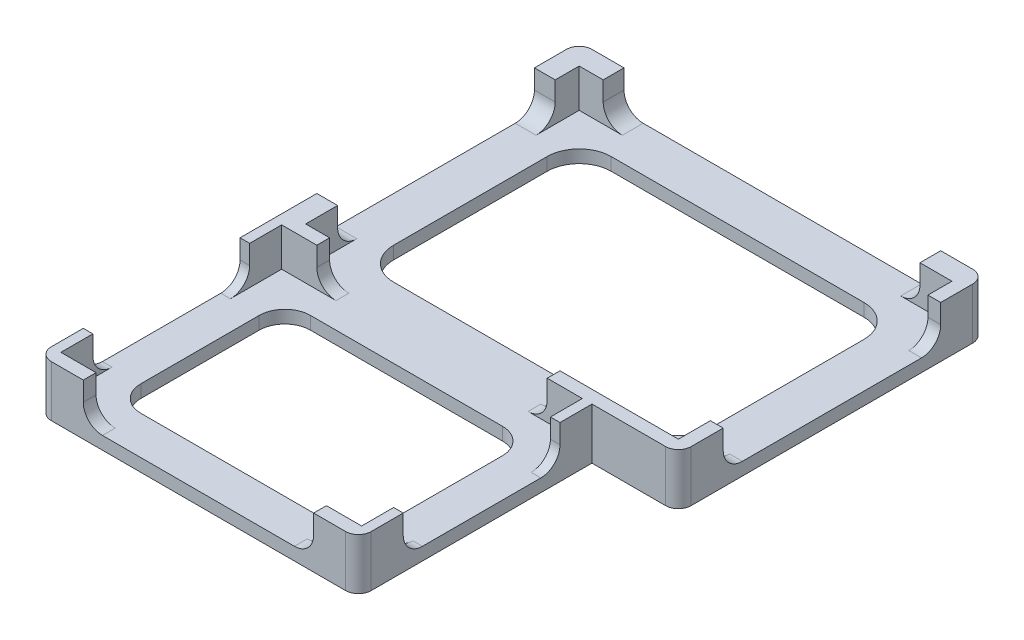
from build123d import *

# Parameters (mm, degrees)
SKETCH1_W            = 63.5
SKETCH1_H            = 48
BOSS_EXTRUDE6_DEPTH  = 21
SKETCH5_W            = 50
SKETCH5_H            = 38.5
BOSS_EXTRUDE7_DEPTH  = 11.5
SKETCH6_W            = 59.5
SKETCH6_H            = 44
CUT_EXTRUDE1_DEPTH   = 19
SKETCH7_W            = 46
SKETCH7_H            = 34.5
CUT_EXTRUDE2_DEPTH   = 9.5
SKETCH8_W            = 50
SKETCH8_H            = 11.5
CUT_EXTRUDE4_DEPTH   = 2
CUT_EXTRUDE6_DEPTH   = 2
CUT_EXTRUDE7_DEPTH   = 2
CUT_EXTRUDE10_DEPTH  = 72
CUT_EXTRUDE11_DEPTH  = 38
SKETCH16_W           = 67
SKETCH16_H           = 6.5
CUT_EXTRUDE13_DEPTH  = 79
CUT_EXTRUDE14_DEPTH  = 79
CUT_EXTRUDE15_DEPTH  = 79
FILLET1_R            = 2
FILLET2_R            = 2
FILLET3_R            = 2
FILLET4_R            = 2
FILLET5_R            = 2
SKETCH19_W           = 36.5
SKETCH19_H           = 2
CUT_EXTRUDE17_DEPTH  = 79
FILLET6_R            = 5
FILLET7_R            = 5
SKETCH20_W           = 4
SKETCH20_H           = 2
BOSS_EXTRUDE16_DEPTH = 18
SKETCH30_W           = 4
SKETCH30_H           = 1
BOSS_EXTRUDE17_DEPTH = 2
SKETCH33_W           = 4
SKETCH33_H           = 1.5
BOSS_EXTRUDE18_DEPTH = 4
SKETCH34_W           = 4
SKETCH34_H           = 1
BOSS_EXTRUDE19_DEPTH = 2
SKETCH36_W           = 4
SKETCH36_H           = 1
CUT_EXTRUDE21_DEPTH  = 2
CUT_EXTRUDE22_DEPTH  = 7
CUT_EXTRUDE25_DEPTH  = 7
SKETCH39_W           = 9.212342007
SKETCH39_H           = 18
CUT_EXTRUDE26_DEPTH  = 10
SKETCH40_W           = 63.5
SKETCH40_H           = 6.5
CUT_EXTRUDE27_DEPTH  = 117
SKETCH44_W           = 34.5
SKETCH44_H           = 6
CUT_EXTRUDE30_DEPTH  = 0.5
SKETCH45_W           = 34.5
SKETCH45_H           = 6
CUT_EXTRUDE31_DEPTH  = 0.5
SKETCH46_W           = 44
SKETCH46_H           = 6
BOSS_EXTRUDE20_DEPTH = 1.25
SKETCH47_W           = 58.25
SKETCH47_H           = 6
BOSS_EXTRUDE21_DEPTH = 1.25
CUT_EXTRUDE32_START  = -1.25
CUT_EXTRUDE32_DEPTH  = 1.25
CUT_EXTRUDE33_DEPTH  = 1.25


with BuildPart() as part:
    # Sketch1 → Boss-Extrude6 (new body)
    with BuildSketch(Plane(origin=(0, 0, 0), x_dir=(1, 0, 0), z_dir=(0, 1, 0))):
        with Locations((31.75, 24)):
            Rectangle(SKETCH1_W, SKETCH1_H)
    extrude(amount=BOSS_EXTRUDE6_DEPTH)

    # Sketch5 → Boss-Extrude7 (add)
    with BuildSketch(Plane(origin=(0, 0, 0), x_dir=(-1, 0, 0), z_dir=(0, -1, 0))):
        with Locations((-25, -19.25)):
            Rectangle(SKETCH5_W, SKETCH5_H)
    extrude(amount=-BOSS_EXTRUDE7_DEPTH)

    # Sketch6 → Cut-Extrude1 (cut)
    with BuildSketch(Plane(origin=(0, 21, 0), x_dir=(1, 0, 0), z_dir=(0, 1, 0))):
        with Locations((31.75, 24)):
            Rectangle(SKETCH6_W, SKETCH6_H)
    extrude(amount=-CUT_EXTRUDE1_DEPTH, mode=Mode.SUBTRACT)

    # Sketch7 → Cut-Extrude2 (cut)
    with BuildSketch(Plane(origin=(0, 11.5, 0), x_dir=(1, 0, 0), z_dir=(0, 1, 0))):
        with Locations((25, -17.25)):
            Rectangle(SKETCH7_W, SKETCH7_H)
    extrude(amount=-CUT_EXTRUDE2_DEPTH, mode=Mode.SUBTRACT)

    # Sketch8 → Cut-Extrude4 (cut)
    with BuildSketch(Plane.XY.offset(38.5)):
        with Locations((25, 5.75)):
            Rectangle(SKETCH8_W, SKETCH8_H)
    extrude(amount=-CUT_EXTRUDE4_DEPTH, mode=Mode.SUBTRACT)

    # Sketch10 → Cut-Extrude6 (cut)
    with BuildSketch(Plane(origin=(0, 2, 0), x_dir=(1, 0, 0), z_dir=(0, 1, 0))):
        with BuildLine():
            Line((12, 7), (51.5, 7))
            ThreePointArc((51.5, 7), (55.035533906, 8.464466094), (56.5, 12))
            Line((56.5, 12), (56.5, 36))
            ThreePointArc((56.5, 36), (55.035533906, 39.535533906), (51.5, 41))
            Line((51.5, 41), (12, 41))
            ThreePointArc((12, 41), (8.464466094, 39.535533906), (7, 36))
            Line((7, 36), (7, 12))
            ThreePointArc((7, 12), (8.464466094, 8.464466094), (12, 7))
        make_face()
    extrude(amount=-CUT_EXTRUDE6_DEPTH, mode=Mode.SUBTRACT)

    # Sketch11 → Cut-Extrude7 (cut)
    with BuildSketch(Plane(origin=(0, 2, 0), x_dir=(1, 0, 0), z_dir=(0, 1, 0))):
        with BuildLine():
            Line((10, -30.5), (40, -30.5))
            ThreePointArc((40, -30.5), (42.828427125, -29.328427125), (44, -26.5))
            Line((44, -26.5), (44, -8))
            ThreePointArc((44, -8), (42.828427125, -5.171572875), (40, -4))
            Line((40, -4), (10, -4))
            ThreePointArc((10, -4), (7.171572875, -5.171572875), (6, -8))
            Line((6, -8), (6, -26.5))
            ThreePointArc((6, -26.5), (7.171572875, -29.328427125), (10, -30.5))
        make_face()
    extrude(amount=-CUT_EXTRUDE7_DEPTH, mode=Mode.SUBTRACT)

    # Sketch13 → Cut-Extrude10 (cut)
    with BuildSketch(Plane(origin=(63.5, 0, 0), x_dir=(0, 0, -1), z_dir=(1, 0, 0))):
        with BuildLine():
            Line((7, 21), (41, 21))
            Line((41, 21), (41, 5))
            ThreePointArc((41, 5), (40.121320344, 2.878679656), (38, 2))
            Line((38, 2), (10, 2))
            ThreePointArc((10, 2), (7.878679656, 2.878679656), (7, 5))
            Line((7, 5), (7, 21))
        make_face()
    extrude(amount=-CUT_EXTRUDE10_DEPTH, mode=Mode.SUBTRACT)

    # Sketch14 → Cut-Extrude11 (cut)
    with BuildSketch(Plane(origin=(0, 0, -48), x_dir=(-1, 0, 0), z_dir=(0, 0, -1))):
        with BuildLine():
            Line((-56.5, 21), (-7, 21))
            Line((-7, 21), (-7, 5))
            ThreePointArc((-7, 5), (-7.878679656, 2.878679656), (-10, 2))
            Line((-10, 2), (-53.5, 2))
            ThreePointArc((-53.5, 2), (-55.621320344, 2.878679656), (-56.5, 5))
            Line((-56.5, 5), (-56.5, 21))
        make_face()
    extrude(amount=-CUT_EXTRUDE11_DEPTH, mode=Mode.SUBTRACT)

    # Sketch16 → Cut-Extrude13 (cut)
    with BuildSketch(Plane(origin=(63.5, 0, 0), x_dir=(0, 0, -1), z_dir=(1, 0, 0))):
        with Locations((14.5, 17.75)):
            Rectangle(SKETCH16_W, SKETCH16_H)
    extrude(amount=-CUT_EXTRUDE13_DEPTH, mode=Mode.SUBTRACT)

    # Sketch17 → Cut-Extrude14 (cut)
    with BuildSketch(Plane(origin=(0, 0, -2), x_dir=(-1, 0, 0), z_dir=(0, 0, -1))):
        with BuildLine():
            Line((-43, 14.5), (-7, 14.5))
            Line((-7, 14.5), (-7, 5))
            ThreePointArc((-7, 5), (-7.878679656, 2.878679656), (-10, 2))
            Line((-10, 2), (-40, 2))
            ThreePointArc((-40, 2), (-42.121320344, 2.878679656), (-43, 5))
            Line((-43, 5), (-43, 14.5))
        make_face()
    extrude(amount=-CUT_EXTRUDE14_DEPTH, mode=Mode.SUBTRACT)

    # Sketch18 → Cut-Extrude15 (cut)
    with BuildSketch(Plane(origin=(50, 0, 0), x_dir=(0, 0, -1), z_dir=(1, 0, 0))):
        with BuildLine():
            Line((-29.5, 11.5), (-5, 11.5))
            Line((-5, 11.5), (-5, 5))
            ThreePointArc((-5, 5), (-5.878679656, 2.878679656), (-8, 2))
            Line((-8, 2), (-26.5, 2))
            ThreePointArc((-26.5, 2), (-28.621320344, 2.878679656), (-29.5, 5))
            Line((-29.5, 5), (-29.5, 11.5))
        make_face()
    extrude(amount=-CUT_EXTRUDE15_DEPTH, mode=Mode.SUBTRACT)

    # Fillet1
    fillet1_edges = [part.edges().sort_by_distance(p)[0] for p in [
        (50, 5.75, 36.5),
    ]]
    fillet(fillet1_edges, radius=FILLET1_R)

    # Fillet2
    fillet2_edges = [part.edges().sort_by_distance(p)[0] for p in [
        (0, 5.75, 36.5),
    ]]
    fillet(fillet2_edges, radius=FILLET2_R)

    # Fillet3
    fillet3_edges = [part.edges().sort_by_distance(p)[0] for p in [
        (0, 7.25, -48),
    ]]
    fillet(fillet3_edges, radius=FILLET3_R)

    # Fillet4
    fillet4_edges = [part.edges().sort_by_distance(p)[0] for p in [
        (63.5, 7.25, -48),
    ]]
    fillet(fillet4_edges, radius=FILLET4_R)

    # Fillet5
    fillet5_edges = [part.edges().sort_by_distance(p)[0] for p in [
        (63.5, 7.25, 0),
    ]]
    fillet(fillet5_edges, radius=FILLET5_R)

    # Sketch19 → Cut-Extrude17 (cut)
    with BuildSketch(Plane(origin=(50, 0, 0), x_dir=(0, 0, -1), z_dir=(1, 0, 0))):
        with Locations((-18.25, 10.5)):
            Rectangle(SKETCH19_W, SKETCH19_H)
    extrude(amount=-CUT_EXTRUDE17_DEPTH, mode=Mode.SUBTRACT)

    # Fillet6
    fillet6_edges = [part.edges().sort_by_distance(p)[0] for p in [
        (1, 9.5, 0),
    ]]
    fillet(fillet6_edges, radius=FILLET6_R - 0.0001)  # a hair under: the kernel refuses the full size

    # Fillet7
    fillet7_edges = [part.edges().sort_by_distance(p)[0] for p in [
        (49, 9.5, 0),
    ]]
    fillet(fillet7_edges, radius=FILLET7_R - 0.0001)  # a hair under: the kernel refuses the full size

    # Sketch20 → Boss-Extrude16 (add)
    with BuildSketch(Plane(origin=(0, 2, 0), x_dir=(1, 0, 0), z_dir=(0, 1, 0))):
        with Locations((25, 1)):
            Rectangle(SKETCH20_W, SKETCH20_H)
    extrude(amount=BOSS_EXTRUDE16_DEPTH)

    # Sketch30 → Boss-Extrude17 (add)
    with BuildSketch(Plane.XY):
        with Locations((25, 19.5)):
            Rectangle(SKETCH30_W, SKETCH30_H)
    extrude(amount=BOSS_EXTRUDE17_DEPTH)

    # Sketch33 → Boss-Extrude18 (add)
    with BuildSketch(Plane.XY):
        with Locations((25, 12.75)):
            Rectangle(SKETCH33_W, SKETCH33_H)
    extrude(amount=BOSS_EXTRUDE18_DEPTH)

    # Sketch34 → Boss-Extrude19 (add)
    with BuildSketch(Plane(origin=(0, 0, -2), x_dir=(-1, 0, 0), z_dir=(0, 0, -1))):
        with Locations((-25, 19.5)):
            Rectangle(SKETCH34_W, SKETCH34_H)
    extrude(amount=BOSS_EXTRUDE19_DEPTH)

    # Sketch36 → Cut-Extrude21 (cut)
    with BuildSketch(Plane.XY.offset(2)):
        with Locations((25, 19.5)):
            Rectangle(SKETCH36_W, SKETCH36_H)
    extrude(amount=-CUT_EXTRUDE21_DEPTH, mode=Mode.SUBTRACT)

    # Sketch37 → Cut-Extrude22 (cut)
    with BuildSketch(Plane(origin=(27, 0, 0), x_dir=(0, 0, -1), z_dir=(1, 0, 0))):
        Polygon((0, 20), (4, 19.257089557), (4, 20), align=None)
    extrude(amount=-CUT_EXTRUDE22_DEPTH, mode=Mode.SUBTRACT)

    # Sketch38 → Cut-Extrude25 (cut)
    with BuildSketch(Plane(origin=(27, 0, 0), x_dir=(0, 0, -1), z_dir=(1, 0, 0))):
        Polygon((0, 13.5), (-4, 10.225610037), (-4, 13.5), align=None)
    extrude(amount=-CUT_EXTRUDE25_DEPTH, mode=Mode.SUBTRACT)

    # Sketch39 → Cut-Extrude26 (cut)
    with BuildSketch(Plane(origin=(27, 0, 0), x_dir=(0, 0, -1), z_dir=(1, 0, 0))):
        with Locations((2.773768612, 11)):
            Rectangle(SKETCH39_W, SKETCH39_H)
    extrude(amount=-CUT_EXTRUDE26_DEPTH, mode=Mode.SUBTRACT)

    # Sketch40 → Cut-Extrude27 (cut)
    with BuildSketch(Plane(origin=(0, 0, -48), x_dir=(-1, 0, 0), z_dir=(0, 0, -1))):
        with Locations((-31.75, 11.25)):
            Rectangle(SKETCH40_W, SKETCH40_H)
    extrude(amount=-CUT_EXTRUDE27_DEPTH, mode=Mode.SUBTRACT)

    # Sketch44 → Cut-Extrude30 (cut)
    with BuildSketch(Plane(origin=(2, 0, 0), x_dir=(0, 0, -1), z_dir=(1, 0, 0))):
        with Locations((-17.25, 5)):
            Rectangle(SKETCH44_W, SKETCH44_H)
    extrude(amount=-CUT_EXTRUDE30_DEPTH, mode=Mode.SUBTRACT)

    # Sketch45 → Cut-Extrude31 (cut)
    with BuildSketch(Plane.ZY.offset(-48)):
        with Locations((17.25, 5)):
            Rectangle(SKETCH45_W, SKETCH45_H)
    extrude(amount=-CUT_EXTRUDE31_DEPTH, mode=Mode.SUBTRACT)

    # Sketch46 → Boss-Extrude20 (add)
    with BuildSketch(Plane(origin=(2, 0, 0), x_dir=(0, 0, -1), z_dir=(1, 0, 0))):
        with Locations((24, 5)):
            Rectangle(SKETCH46_W, SKETCH46_H)
    extrude(amount=BOSS_EXTRUDE20_DEPTH)

    # Sketch47 → Boss-Extrude21 (add)
    with BuildSketch(Plane.XY.offset(-46)):
        with Locations((32.375, 5)):
            Rectangle(SKETCH47_W, SKETCH47_H)
    extrude(amount=BOSS_EXTRUDE21_DEPTH)

    # Sketch48 → Cut-Extrude32 (cut)
    with BuildSketch(Plane.ZY.offset(-2).offset(CUT_EXTRUDE32_START)):
        with BuildLine():
            Line((-7, 8), (-41, 8))
            Line((-41, 8), (-41, 5))
            ThreePointArc((-41, 5), (-40.121320344, 2.878679656), (-38, 2))
            Line((-38, 2), (-10, 2))
            ThreePointArc((-10, 2), (-7.878679656, 2.878679656), (-7, 5))
            Line((-7, 5), (-7, 8))
        make_face()
    extrude(amount=CUT_EXTRUDE32_DEPTH, mode=Mode.SUBTRACT)

    # Sketch49 → Cut-Extrude33 (cut)
    with BuildSketch(Plane(origin=(0, 0, -46), x_dir=(-1, 0, 0), z_dir=(0, 0, -1))):
        with BuildLine():
            Line((-7, 8), (-56.5, 8))
            Line((-56.5, 8), (-56.5, 5))
            ThreePointArc((-56.5, 5), (-55.621320344, 2.878679656), (-53.5, 2))
            Line((-53.5, 2), (-10, 2))
            ThreePointArc((-10, 2), (-7.878679656, 2.878679656), (-7, 5))
            Line((-7, 5), (-7, 8))
        make_face()
    extrude(amount=-CUT_EXTRUDE33_DEPTH, mode=Mode.SUBTRACT)


solid = part.part
